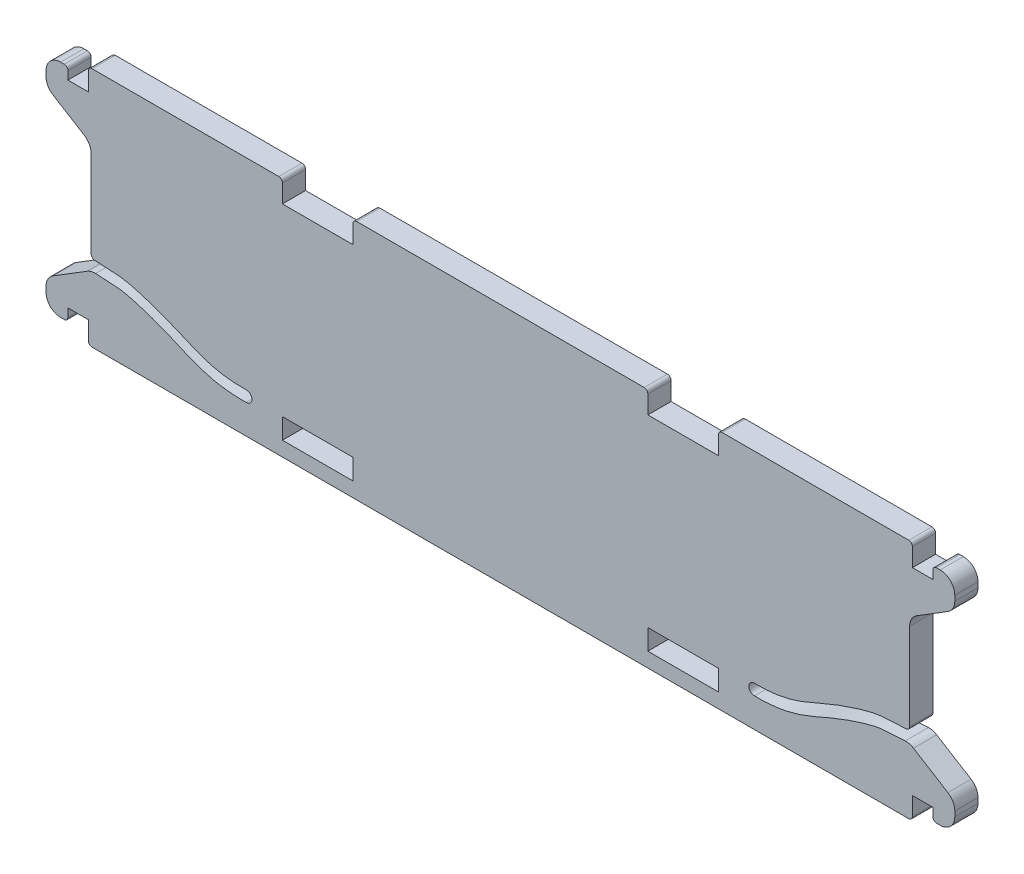
from build123d import *

# Parameters (mm, degrees)
SKETCH1_W           = 124.35
SKETCH1_H           = 33
BOSS_EXTRUDE1_DEPTH = 3.175
SKETCH2_W           = 9.65
SKETCH2_H           = 2.8
SKETCH2_H_2         = 3
CUT_EXTRUDE1_DEPTH  = 65.405444257
SKETCH4_W           = 2.8
SKETCH4_H           = 3
SKETCH4_W_2         = 6.175
SKETCH4_H_2         = 15
CUT_EXTRUDE2_DEPTH  = 65.405444257
SKETCH6_W           = 3
SKETCH6_H           = 1.375
CUT_EXTRUDE3_DEPTH  = 65.405444257
CUT_SWEEP1_DEPTH    = 3.175
SKETCH12_R          = 0.75
CUT_EXTRUDE6_DEPTH  = 65.405444385
CUT_EXTRUDE7_DEPTH  = 65.405444385
FILLET6_R           = 2
FILLET7_R           = 0.5


# Read off the part's stored shape, not the designer's step: Cut-Sweep1
with BuildPart() as part:
    # Sketch1 → Boss-Extrude1 (new body)
    with BuildSketch(Plane.XY):
        Rectangle(SKETCH1_W, SKETCH1_H)
    extrude(amount=BOSS_EXTRUDE1_DEPTH)

    # Sketch2 → Cut-Extrude1 (cut, through all)
    with BuildSketch(Plane.XY.offset(3.175)):
        with Locations((-25, -13.1)):
            Rectangle(SKETCH2_W, SKETCH2_H)
        with Locations((25, -13.1)):
            Rectangle(SKETCH2_W, SKETCH2_H)
        with Locations((-25, 15)):
            Rectangle(SKETCH2_W, SKETCH2_H_2)
        with Locations((25, 15)):
            Rectangle(SKETCH2_W, SKETCH2_H_2)
    extrude(amount=-CUT_EXTRUDE1_DEPTH, mode=Mode.SUBTRACT)

    # Sketch4 → Cut-Extrude2 (cut, through all)
    with BuildSketch(Plane.XY.offset(3.175)):
        with Locations((-57.775, 15)):
            Rectangle(SKETCH4_W, SKETCH4_H)
        with Locations((-59.0875, 0)):
            Rectangle(SKETCH4_W_2, SKETCH4_H_2)
        with Locations((-57.775, -15)):
            Rectangle(SKETCH4_W, SKETCH4_H)
        with Locations((57.775, 15)):
            Rectangle(SKETCH4_W, SKETCH4_H)
        with Locations((59.0875, 0)):
            Rectangle(SKETCH4_W_2, SKETCH4_H_2)
        with Locations((57.775, -15)):
            Rectangle(SKETCH4_W, SKETCH4_H)
    extrude(amount=-CUT_EXTRUDE2_DEPTH, mode=Mode.SUBTRACT)

    # Sketch6 → Cut-Extrude3 (cut, through all)
    with BuildSketch(Plane.XY.offset(3.175)):
        with Locations((-60.675, 15.8125)):
            Rectangle(SKETCH6_W, SKETCH6_H)
        with Locations((-60.675, -15.8125)):
            Rectangle(SKETCH6_W, SKETCH6_H)
        with Locations((60.675, 15.8125)):
            Rectangle(SKETCH6_W, SKETCH6_H)
        with Locations((60.675, -15.8125)):
            Rectangle(SKETCH6_W, SKETCH6_H)
    extrude(amount=-CUT_EXTRUDE3_DEPTH, mode=Mode.SUBTRACT)

    # Cut-Sweep1 outline → Cut-Sweep1 (cut)
    with BuildSketch(Plane.XY):
        with BuildLine():
            add(Edge.make_bspline(
                [(-56, -6), (-55.016272395, -6.040912607), (-53.484317245, -6.110006936), (-52.10462272, -6.208217255), (-51.370216858, -6.312882143), (-50.849013323, -6.424427059), (-50.274077583, -6.562740427), (-49.507561658, -6.770408498), (-47.98416767, -7.234467607), (-46.535590196, -7.742954919), (-44.899823838, -8.383891144), (-43.265010906, -9.091671777), (-41.074137026, -10.055384808), (-38.357692762, -10.850187014), (-36.1078612, -11.027108547), (-34.793437631, -10.999002823)],
                knots=[0, 0, 0, 0, 0.052266667, 0.104533333, 0.1568, 0.188540911, 0.209066667, 0.261333333, 0.3136, 0.4368, 0.46346514, 0.56, 0.706666667, 0.853333333, 1, 1, 1, 1], degree=3))
            Line((-56, -6), (-56, -7.5))
            add(Edge.make_bspline(
                [(-56, -7.5), (-55.020423649, -7.540842864), (-53.496771007, -7.609797709), (-52.171479553, -7.70829789), (-51.569513747, -7.80075633), (-51.115986388, -7.900930823), (-50.592043829, -8.028791809), (-49.863497697, -8.22781936), (-48.398796638, -8.676488924), (-46.992197023, -9.172450468), (-45.412650318, -9.7933523), (-43.831176536, -10.480660701), (-41.561928867, -11.478467634), (-38.556226285, -12.350501385), (-36.110914304, -12.525218982), (-34.698750526, -12.49601129)],
                knots=[0, 0, 0, 0, 0.052266667, 0.104533333, 0.1568, 0.188540911, 0.209066667, 0.261333333, 0.3136, 0.4368, 0.46346514, 0.56, 0.706666667, 0.853333333, 1, 1, 1, 1], degree=3))
            Line((-34.698750526, -12.49601129), (-34.793437631, -10.999002823))
        make_face()
    cut_sweep1 = extrude(amount=CUT_SWEEP1_DEPTH, mode=Mode.SUBTRACT)

    # Mirror1: Cut-Sweep1 across plane
    add(cut_sweep1.mirror(Plane.ZY), mode=Mode.SUBTRACT)

    # Sketch12 → Cut-Extrude6 (cut, through all)
    with BuildSketch(Plane.XY.offset(3.175)):
        with Locations((-34.746094079, -11.747507056)):
            Circle(SKETCH12_R)
        with Locations((34.746094079, -11.747507056)):
            Circle(SKETCH12_R)
    extrude(amount=-CUT_EXTRUDE6_DEPTH, mode=Mode.SUBTRACT)

    # Sketch13 → Cut-Extrude7 (cut, through all)
    with BuildSketch(Plane.XY.offset(3.175)):
        Polygon((-56, 7.5), (-62.175, 11.3125), (-62.175, 7.5), align=None)
        Polygon((-56, -7.5), (-62.175, -11.3125), (-62.175, -7.5), align=None)
        Polygon((56, 7.5), (62.175, 11.3125), (62.175, 7.5), align=None)
        Polygon((56, -7.5), (62.175, -11.3125), (62.175, -7.5), align=None)
    extrude(amount=-CUT_EXTRUDE7_DEPTH, mode=Mode.SUBTRACT)

    # Fillet6
    fillet6_edges = [part.edges().sort_by_distance(p)[0] for p in [
        (62.175, -15.125, 1.5875),
        (62.175, -11.3125, 1.5875),
        (56, -7.5, 1.5875),
        (56, 7.5, 1.5875),
        (62.175, 11.3125, 1.5875),
        (62.175, 15.125, 1.5875),
        (-62.175, -15.125, 1.5875),
        (-62.175, -11.3125, 1.5875),
        (-56, -7.5, 1.5875),
        (-62.175, 15.125, 1.5875),
        (-62.175, 11.3125, 1.5875),
        (-56, 7.5, 1.5875),
    ]]
    fillet(fillet6_edges, radius=FILLET6_R)

    # Fillet7
    fillet7_edges = [part.edges().sort_by_distance(p)[0] for p in [
        (59.175, 15.125, 1.5875),
        (59.175, -15.125, 1.5875),
        (-59.175, -15.125, 1.5875),
        (-59.175, 15.125, 1.5875),
        (20.175, 16.5, 1.5875),
        (29.825, 16.5, 1.5875),
        (-20.175, 16.5, 1.5875),
        (-29.825, 16.5, 1.5875),
        (56.375, -16.5, 1.5875),
        (56, -6, 1.5875),
        (56.375, 16.5, 1.5875),
        (-56.375, 16.5, 1.5875),
        (-56.375, -16.5, 1.5875),
        (-56, -6, 1.5875),
    ]]
    fillet(fillet7_edges, radius=FILLET7_R)


solid = part.part
